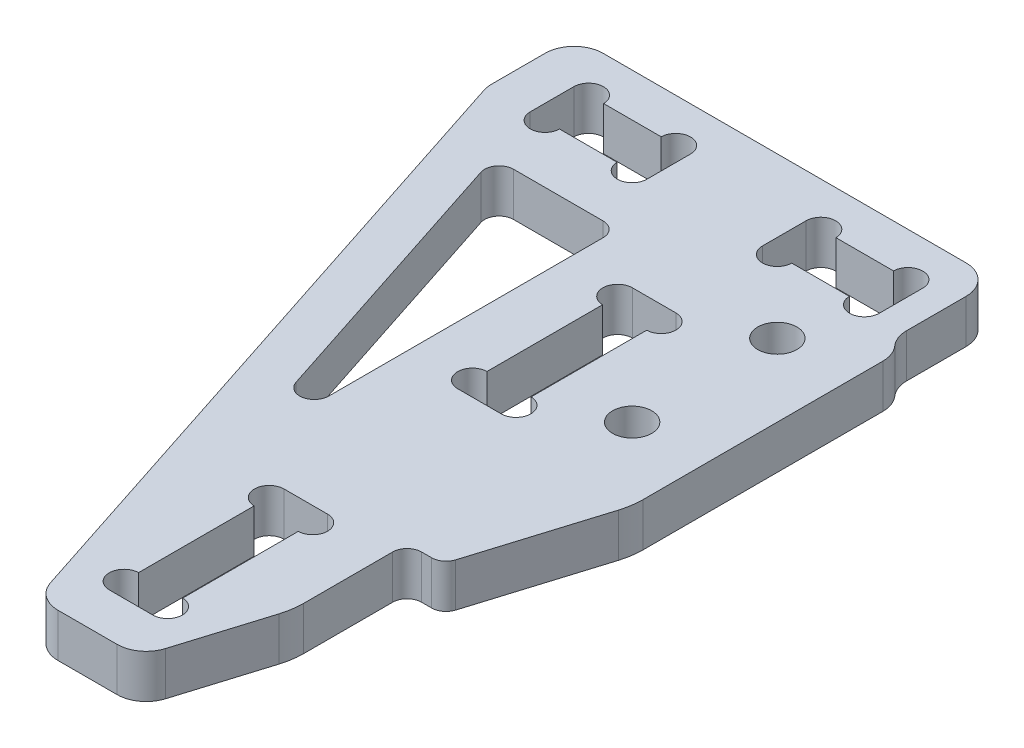
from build123d import *
from OCP.BRepFilletAPI import BRepFilletAPI_MakeFillet

# Parameters (mm, degrees)
SKETCH_1_W             = 3
SKETCH_1_H             = 12
SKETCH_1_W_2           = 8
SKETCH_1_H_2           = 3
EXTRUDE_1_DEPTH        = 3
SKETCH_3_R             = 1
CUT_EXTRUDE_1_DEPTH    = 55.203320931
SKETCH_4_W             = 1
SKETCH_4_H             = 7
CUT_EXTRUDE_2_DEPTH    = 55.203320931
SKETCH_6_R             = 1.35
CUT_EXTRUDE_3_DEPTH    = 55.203320931
CUT_EXTRUDE_4_DEPTH    = 55.203320931
CUT_EXTRUDE_6_DEPTH    = 55.203320931
FILLET_1_R             = 2
FILLET_2_R1            = 5
FILLET_2_R2            = 1
FILLET_2_R3            = 2
CUT_EXTRUDE_5602_DEPTH = 55.203320931
FILLET_3_R1            = 1
FILLET_3_R2            = 5


with BuildPart() as part:
    # 草图1 → 凸台-拉伸1 (new body)
    with BuildSketch(Plane(origin=(0, 0, 0), x_dir=(1, 0, 0), z_dir=(0, 1, 0))):
        Polygon((15, 26), (15, 52), (0, 52), (-15, 52), (-15, 46), (0, 0), (7, 0), align=None)
        with Locations((3.5, 9)):
            Rectangle(SKETCH_1_W, SKETCH_1_H, mode=Mode.SUBTRACT)
        with Locations((3.5, 33)):
            Rectangle(SKETCH_1_W, SKETCH_1_H, mode=Mode.SUBTRACT)
        with Locations((-8, 47.5)):
            Rectangle(SKETCH_1_W_2, SKETCH_1_H_2, mode=Mode.SUBTRACT)
        with Locations((8, 47.5)):
            Rectangle(SKETCH_1_W_2, SKETCH_1_H_2, mode=Mode.SUBTRACT)
    extrude(amount=EXTRUDE_1_DEPTH)

    # 草图3 → 切除-拉伸1 (cut, through all)
    with BuildSketch(Plane(origin=(0, 3, 0), x_dir=(1, 0, 0), z_dir=(0, 1, 0))):
        with Locations((5, 4)):
            Circle(SKETCH_3_R)
        with Locations((5, 14)):
            Circle(SKETCH_3_R)
        with Locations((2, 4)):
            Circle(SKETCH_3_R)
        with Locations((2, 14)):
            Circle(SKETCH_3_R)
        with Locations((2, 28)):
            Circle(SKETCH_3_R)
        with Locations((2, 38)):
            Circle(SKETCH_3_R)
        with Locations((5, 28)):
            Circle(SKETCH_3_R)
        with Locations((5, 38)):
            Circle(SKETCH_3_R)
        with Locations((-5, 49)):
            Circle(SKETCH_3_R)
        with Locations((-11, 49)):
            Circle(SKETCH_3_R)
        with Locations((-11, 46)):
            Circle(SKETCH_3_R)
        with Locations((-5, 46)):
            Circle(SKETCH_3_R)
        with Locations((5, 46)):
            Circle(SKETCH_3_R)
        with Locations((11, 46)):
            Circle(SKETCH_3_R)
        with Locations((11, 49)):
            Circle(SKETCH_3_R)
        with Locations((5, 49)):
            Circle(SKETCH_3_R)
    extrude(amount=-CUT_EXTRUDE_1_DEPTH, mode=Mode.SUBTRACT)

    # 草图4 → 切除-拉伸2 (cut, through all)
    with BuildSketch(Plane.XZ):
        with Locations((14.5, -48.5)):
            Rectangle(SKETCH_4_W, SKETCH_4_H)
    extrude(amount=-CUT_EXTRUDE_2_DEPTH, mode=Mode.SUBTRACT)

    # 草图6 → 切除-拉伸3 (cut, through all)
    with BuildSketch(Plane(origin=(0, 3, 0), x_dir=(1, 0, 0), z_dir=(0, 1, 0))):
        with Locations(Location((10, 31, 0), (0, 0, 270))):
            Circle(SKETCH_6_R)
        with Locations(Location((10, 41, 0), (0, 0, 90))):
            Circle(SKETCH_6_R)
    extrude(amount=-CUT_EXTRUDE_3_DEPTH, mode=Mode.SUBTRACT)

    # 草图7 → 切除-拉伸4 (cut, through all)
    with BuildSketch(Plane(origin=(0, 3, 0), x_dir=(1, 0, 0), z_dir=(0, 1, 0))):
        Polygon((-2, 15.810109656), (-10.540181634, 42), (-2, 42), align=None)
    extrude(amount=-CUT_EXTRUDE_4_DEPTH, mode=Mode.SUBTRACT)

    # 草图9 → 切除-拉伸6 (cut, through all)
    with BuildSketch(Plane.XZ):
        Polygon((11.923076923, -16), (9.5, -16), (9.5, -8.125), align=None)
    extrude(amount=-CUT_EXTRUDE_6_DEPTH, mode=Mode.SUBTRACT)

    # 圆角1
    # the kernel refuses this fillet: 2 mm, written as the material it takes off along each edge
    with BuildSketch(Plane(origin=(15, -4.330127019, -45), x_dir=(0, 0, 1), z_dir=(0, 1, 0))) as fillet_1_piece_1:
        with BuildLine():
            CenterArc((1.732050808, -2), FILLET_1_R, 90, 60)
            Line((0, -1), (-0.034641016, -0.98))
            ThreePointArc((-0.034641016, -0.98), (-0.04, -0.5), (-0.04, 0))
            Line((-0.04, 0), (0, 0.04))
            Line((0, 0.04), (1.732050808, 0.04))
            Line((1.732050808, 0.04), (1.732050808, 0))
        make_face()
    extrude(amount=11.660254038, mode=Mode.SUBTRACT)
    with BuildSketch(Plane(origin=(7, -3.692873273, 0), x_dir=(-1, 0, 0), z_dir=(0, 1, 0))) as fillet_1_piece_2:
        with BuildLine():
            CenterArc((FILLET_1_R * 0.738574654518, -FILLET_1_R), FILLET_1_R, 90, 72.897271031)
            Line((-FILLET_1_R * 0.217204354204, -FILLET_1_R * 0.705914151162), (-FILLET_1_R * 0.236319934378, -FILLET_1_R * 0.700032434186))
            Line((-FILLET_1_R * 0.236319934378, -FILLET_1_R * 0.700032434186), (-FILLET_1_R * 0.0147714930904, FILLET_1_R * 0.02))
            Line((-FILLET_1_R * 0.0147714930904, FILLET_1_R * 0.02), (FILLET_1_R * 0.738574654518, FILLET_1_R * 0.02))
            Line((FILLET_1_R * 0.738574654518, FILLET_1_R * 0.02), (FILLET_1_R * 0.738574654518, 0))
        make_face()
    extrude(amount=10.385746545, mode=Mode.SUBTRACT)
    with BuildSketch(Plane(origin=(0, -3.628682784, 0), x_dir=(1, 0, 0), z_dir=(0, 1, 0))) as fillet_1_piece_3:
        with BuildLine():
            CenterArc((FILLET_1_R * 0.725736556818, FILLET_1_R), FILLET_1_R, 198.060471936, 71.939528064)
            Line((-FILLET_1_R * 0.224993282664, FILLET_1_R * 0.689979400169), (-FILLET_1_R * 0.244007879453, FILLET_1_R * 0.683778988172))
            Line((-FILLET_1_R * 0.244007879453, FILLET_1_R * 0.683778988172), (-FILLET_1_R * 0.0145147311364, -FILLET_1_R * 0.02))
            Line((-FILLET_1_R * 0.0145147311364, -FILLET_1_R * 0.02), (FILLET_1_R * 0.725736556818, -FILLET_1_R * 0.02))
            Line((FILLET_1_R * 0.725736556818, -FILLET_1_R * 0.02), (FILLET_1_R * 0.725736556818, 0))
        make_face()
    extrude(amount=10.257365568, mode=Mode.SUBTRACT)
    with BuildSketch(Plane(origin=(-15, -0.794627205, -46), x_dir=(0.31002059983091895, 0, 0.9507298394814782), z_dir=(0, 1, 0))) as fillet_1_piece_4:
        with BuildLine():
            CenterArc((FILLET_1_R * 0.158925440907, FILLET_1_R), FILLET_1_R, 251.939528064, 18.060471936)
            Line((-FILLET_1_R * 0.151095158923, FILLET_1_R * 0.0492701605185), (-FILLET_1_R * 0.15729557092, FILLET_1_R * 0.0302555637289))
            Line((-FILLET_1_R * 0.15729557092, FILLET_1_R * 0.0302555637289), (-FILLET_1_R * 0.00317850881815, -FILLET_1_R * 0.02))
            Line((-FILLET_1_R * 0.00317850881815, -FILLET_1_R * 0.02), (FILLET_1_R * 0.158925440907, -FILLET_1_R * 0.02))
            Line((FILLET_1_R * 0.158925440907, -FILLET_1_R * 0.02), (FILLET_1_R * 0.158925440907, 0))
        make_face()
    extrude(amount=4.589254409, mode=Mode.SUBTRACT)
    with BuildSketch(Plane(origin=(14, -5, -52), x_dir=(-1, 0, 0), z_dir=(0, 1, 0)), Plane(origin=(-15, -5, -52), x_dir=(0, 0, 1), z_dir=(0, 1, 0))) as fillet_1_piece_5:
        with BuildLine():
            CenterArc((FILLET_1_R, FILLET_1_R), FILLET_1_R, 180, 90)
            Line((0, FILLET_1_R), (-FILLET_1_R * 0.02, FILLET_1_R))
            Line((-FILLET_1_R * 0.02, FILLET_1_R), (-FILLET_1_R * 0.02, -FILLET_1_R * 0.02))
            Line((-FILLET_1_R * 0.02, -FILLET_1_R * 0.02), (FILLET_1_R, -FILLET_1_R * 0.02))
            Line((FILLET_1_R, -FILLET_1_R * 0.02), (FILLET_1_R, 0))
        make_face()
    extrude(amount=13, mode=Mode.SUBTRACT)

    # 圆角2: one fillet with a radius per group of edges: ONE call of the kernel's fillet builder (fillet() takes one radius for all edges)
    fillet_2_edges_1 = [part.edges().sort_by_distance(p)[0] for p in [
        (15, 1.5, -26),
    ]]
    fillet_2_edges_2 = [part.edges().sort_by_distance(p)[0] for p in [
        (-10.540181634, 1.5, -42),
        (-2, 1.5, -42),
        (-2, 1.5, -15.810109656),
    ]]
    fillet_2_edges_3 = [part.edges().sort_by_distance(p)[0] for p in [
        (14, 1.5, -45),
    ]]
    fillet_2 = BRepFilletAPI_MakeFillet(part.part.solid().wrapped)
    for e in fillet_2_edges_1:
        fillet_2.Add(FILLET_2_R1, e.wrapped)
    for e in fillet_2_edges_2:
        fillet_2.Add(FILLET_2_R2, e.wrapped)
    for e in fillet_2_edges_3:
        fillet_2.Add(FILLET_2_R3, e.wrapped)
    add(Compound.cast(fillet_2.Shape()), mode=Mode.REPLACE)

    # 草图8 → Cut-Extrude 5602 (cut, through all)
    with BuildSketch(Plane(origin=(0, 3, 0), x_dir=(1, 0, 0), z_dir=(0, 1, 0))):
        with BuildLine():
            Line((9.980196097, 49.02), (6.019803903, 49.02))
            ThreePointArc((6.019803903, 49.02), (4.989999519, 50.019950975), (3.98, 49))
            Line((3.98, 49), (3.98, 46))
            ThreePointArc((3.98, 46), (4.989999519, 44.980049025), (6.019803903, 45.98))
            Line((6.019803903, 45.98), (9.980196097, 45.98))
            ThreePointArc((9.980196097, 45.98), (11.010000481, 44.980049025), (12.02, 46))
            Line((12.02, 46), (12.02, 49))
            ThreePointArc((12.02, 49), (11.010000481, 50.019950975), (9.980196097, 49.02))
        make_face()
        with BuildLine():
            Line((-12.02, 46), (-12.02, 49))
            ThreePointArc((-12.02, 49), (-11.010000481, 50.019950975), (-9.980196097, 49.02))
            Line((-9.980196097, 49.02), (-6.019803903, 49.02))
            ThreePointArc((-6.019803903, 49.02), (-4.989999519, 50.019950975), (-3.98, 49))
            Line((-3.98, 49), (-3.98, 46))
            ThreePointArc((-3.98, 46), (-4.989999519, 44.980049025), (-6.019803903, 45.98))
            Line((-6.019803903, 45.98), (-9.980196097, 45.98))
            ThreePointArc((-9.980196097, 45.98), (-11.010000481, 44.980049025), (-12.02, 46))
        make_face()
        with BuildLine():
            Line((1.98, 36.980196097), (1.98, 29.019803903))
            ThreePointArc((1.98, 29.019803903), (0.980049025, 27.989999519), (2, 26.98))
            Line((2, 26.98), (5, 26.98))
            ThreePointArc((5, 26.98), (6.019950975, 27.989999519), (5.02, 29.019803903))
            Line((5.02, 29.019803903), (5.02, 36.980196097))
            ThreePointArc((5.02, 36.980196097), (6.019950975, 38.010000481), (5, 39.02))
            Line((5, 39.02), (2, 39.02))
            ThreePointArc((2, 39.02), (0.980049025, 38.010000481), (1.98, 36.980196097))
        make_face()
        with BuildLine():
            Line((5, 2.98), (2, 2.98))
            ThreePointArc((2, 2.98), (0.980049025, 3.989999519), (1.98, 5.019803903))
            Line((1.98, 5.019803903), (1.98, 12.980196097))
            ThreePointArc((1.98, 12.980196097), (0.980049025, 14.010000481), (2, 15.02))
            Line((2, 15.02), (5, 15.02))
            ThreePointArc((5, 15.02), (6.019950975, 14.010000481), (5.02, 12.980196097))
            Line((5.02, 12.980196097), (5.02, 5.019803903))
            ThreePointArc((5.02, 5.019803903), (6.019950975, 3.989999519), (5, 2.98))
        make_face()
    extrude(amount=-CUT_EXTRUDE_5602_DEPTH, mode=Mode.SUBTRACT)

    # 圆角3: one fillet with a radius per group of edges: ONE call of the kernel's fillet builder (fillet() takes one radius for all edges)
    fillet_3_edges_1 = [part.edges().sort_by_distance(p)[0] for p in [
        (9.5, 1.5, -16),
        (11.923076923, 1.5, -16),
    ]]
    fillet_3_edges_2 = [part.edges().sort_by_distance(p)[0] for p in [
        (9.5, 1.5, -8.125),
    ]]
    fillet_3 = BRepFilletAPI_MakeFillet(part.part.solid().wrapped)
    for e in fillet_3_edges_1:
        fillet_3.Add(FILLET_3_R1, e.wrapped)
    for e in fillet_3_edges_2:
        fillet_3.Add(FILLET_3_R2, e.wrapped)
    add(Compound.cast(fillet_3.Shape()), mode=Mode.REPLACE)


solid = part.part
